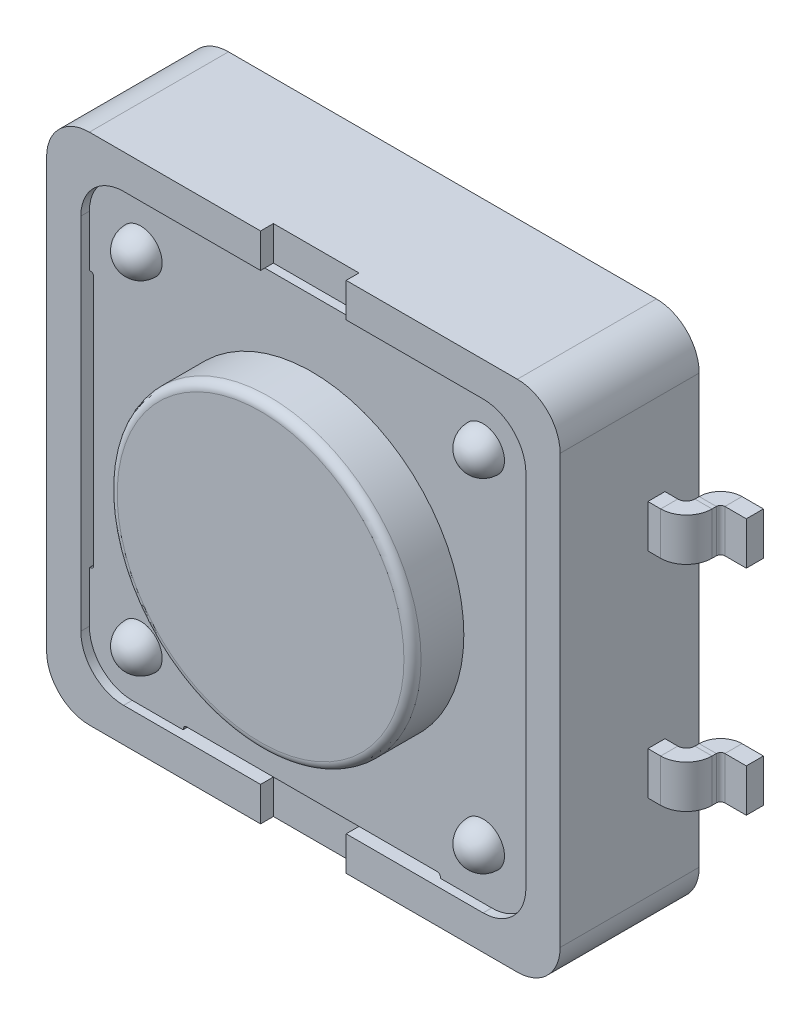
from build123d import *

# Parameters (mm, degrees)
BOSS_EXTRUDE1_DEPTH               = 3.25
BOSS_EXTRUDE3_START               = 0.8
SKETCH2_W                         = 6
SKETCH2_H                         = 1
BOSS_EXTRUDE3_DEPTH               = 0.4
BOSS_EXTRUDE3_2_DEPTH             = 0.4
SM_START                          = 2
SM_EDGE_FLANGE_1_DEPTH            = 1
SM_START_2                        = -3
SM_EDGE_FLANGE_2_DEPTH            = 1
SM_EDGE_FLANGE_3_DEPTH            = 1
SM_EDGE_FLANGE_4_DEPTH            = 1
SM_EDGE_FLANGE_8_STRIP_W          = 1.8
SM_EDGE_FLANGE_8_STRIP_H          = 0.4
SM_EDGE_FLANGE_8_STRIP_CUT_DEPTH  = 1
SM_EDGE_FLANGE_8_DEPTH            = 1
SM_EDGE_FLANGE_9_STRIP_W          = 1.8
SM_EDGE_FLANGE_9_STRIP_H          = 0.4
SM_EDGE_FLANGE_9_STRIP_CUT_DEPTH  = 1
SM_EDGE_FLANGE_9_DEPTH            = 1
SM_EDGE_FLANGE_10_STRIP_W         = 1.8
SM_EDGE_FLANGE_10_STRIP_H         = 0.4
SM_EDGE_FLANGE_10_STRIP_CUT_DEPTH = 1
SM_EDGE_FLANGE_10_DEPTH           = 1
SM_EDGE_FLANGE_11_STRIP_W         = 1.8
SM_EDGE_FLANGE_11_STRIP_H         = 0.4
SM_EDGE_FLANGE_11_STRIP_CUT_DEPTH = 1
SM_EDGE_FLANGE_11_DEPTH           = 1
CUT_EXTRUDE1_DEPTH                = 15.519383596
CUT_EXTRUDE1_DEPTH_BACK           = 15.519383596
SKETCH41_W                        = 2
SKETCH41_H                        = 0.6
BOSS_EXTRUDE4_DEPTH               = 0.1
BOSS_EXTRUDE4_DEPTH_BACK          = 0.4
SKETCH42_R                        = 3.55
SKETCH42_R_2                      = 0.5
SKETCH43_W                        = 10.885963184
SKETCH43_H                        = 10.885963184
BOSS_EXTRUDE5_DEPTH               = 2.55
BOSS_EXTRUDE6_START               = 0.5
SKETCH46_R                        = 0.5
BOSS_EXTRUDE6_DEPTH               = 0.5
BOSS_EXTRUDE6_2_DEPTH             = 0.5
BOSS_EXTRUDE6_3_DEPTH             = 0.5
BOSS_EXTRUDE6_4_DEPTH             = 0.5
FILLET1_R                         = 0.5
FILLET2_R                         = 0.5
FILLET3_R                         = 0.5
FILLET4_R                         = 0.5
BOSS_EXTRUDE7_START               = 0.5
SKETCH47_R                        = 3.55
BOSS_EXTRUDE7_DEPTH               = 1.2
FILLET5_R                         = 0.2
SKETCH48_W                        = 0.053846154
SKETCH48_H                        = 0.3
CUT_EXTRUDE2_DEPTH                = 0.05


# Read off the part's stored shape, not the designer's step: Ребро-кромка1, Ребро-кромка2, Ребро-кромка3, Ребро-кромка4
# Sheet-metal steps are written as plain solids
with BuildPart() as part:
    # Sketch1 → Boss-Extrude1 (new body)
    with BuildSketch(Plane.XY):
        with BuildLine():
            Line((-5, 6), (5, 6))
            ThreePointArc((5, 6), (5.707106781, 5.707106781), (6, 5))
            Line((6, 5), (6, -5))
            ThreePointArc((6, -5), (5.707106781, -5.707106781), (5, -6))
            Line((5, -6), (-5, -6))
            ThreePointArc((-5, -6), (-5.707106781, -5.707106781), (-6, -5))
            Line((-6, -5), (-6, 5))
            ThreePointArc((-6, 5), (-5.707106781, 5.707106781), (-5, 6))
        make_face()
        with BuildLine():
            Line((-4.2, 5.2), (4.2, 5.2))
            ThreePointArc((4.2, 5.2), (4.907106781, 4.907106781), (5.2, 4.2))
            Line((5.2, 4.2), (5.2, -4.2))
            ThreePointArc((5.2, -4.2), (4.907106781, -4.907106781), (4.2, -5.2))
            Line((4.2, -5.2), (-4.2, -5.2))
            ThreePointArc((-4.2, -5.2), (-4.907106781, -4.907106781), (-5.2, -4.2))
            Line((-5.2, -4.2), (-5.2, 4.2))
            ThreePointArc((-5.2, 4.2), (-4.907106781, 4.907106781), (-4.2, 5.2))
        make_face(mode=Mode.SUBTRACT)
    extrude(amount=BOSS_EXTRUDE1_DEPTH)

    # Sketch41 → Cut-Extrude1 (cut, two sides: drawn at the far end of the back side and taken through both)
    with BuildSketch(Plane(origin=(0, -6, 0), x_dir=(-1, 0, 0), z_dir=(0, -1, 0)).offset(-CUT_EXTRUDE1_DEPTH_BACK)):
        with Locations((0, -3.25)):
            Rectangle(SKETCH41_W, SKETCH41_H)
    extrude(amount=CUT_EXTRUDE1_DEPTH + CUT_EXTRUDE1_DEPTH_BACK, mode=Mode.SUBTRACT)

    # Sketch42 → Boss-Extrude4 (add, two sides: drawn at the far end of the back side and taken through both)
    with BuildSketch(Plane.XY.offset(2.95).offset(-BOSS_EXTRUDE4_DEPTH_BACK)):
        with BuildLine():
            Line((-5.2, 3.02), (-5.2, 4.2))
            ThreePointArc((-5.2, 4.2), (-4.907106781, 4.907106781), (-4.2, 5.2))
            Line((-4.2, 5.2), (-3.02, 5.2))
            ThreePointArc((-3.02, 5.2), (-3.005857864, 5.194142136), (-3, 5.18))
            Line((-3, 5.18), (-3, 5.17))
            ThreePointArc((-3, 5.17), (-2.979497475, 5.120502525), (-2.93, 5.1))
            Line((-2.93, 5.1), (2.93, 5.1))
            ThreePointArc((2.93, 5.1), (2.979497475, 5.120502525), (3, 5.17))
            Line((3, 5.17), (3, 5.18))
            ThreePointArc((3, 5.18), (3.005857864, 5.194142136), (3.02, 5.2))
            Line((3.02, 5.2), (4.2, 5.2))
            ThreePointArc((4.2, 5.2), (4.907106781, 4.907106781), (5.2, 4.2))
            Line((5.2, 4.2), (5.2, 3.02))
            ThreePointArc((5.2, 3.02), (5.194142136, 3.005857864), (5.18, 3))
            Line((5.18, 3), (5.17, 3))
            ThreePointArc((5.17, 3), (5.120502525, 2.979497475), (5.1, 2.93))
            Line((5.1, 2.93), (5.1, -2.93))
            ThreePointArc((5.1, -2.93), (5.120502525, -2.979497475), (5.17, -3))
            Line((5.17, -3), (5.18, -3))
            ThreePointArc((5.18, -3), (5.194142136, -3.005857864), (5.2, -3.02))
            Line((5.2, -3.02), (5.2, -4.2))
            ThreePointArc((5.2, -4.2), (4.907106781, -4.907106781), (4.2, -5.2))
            Line((4.2, -5.2), (3.02, -5.2))
            ThreePointArc((3.02, -5.2), (3.005857864, -5.194142136), (3, -5.18))
            Line((3, -5.18), (3, -5.17))
            ThreePointArc((3, -5.17), (2.979497475, -5.120502525), (2.93, -5.1))
            Line((2.93, -5.1), (-2.93, -5.1))
            ThreePointArc((-2.93, -5.1), (-2.979497475, -5.120502525), (-3, -5.17))
            Line((-3, -5.17), (-3, -5.18))
            ThreePointArc((-3, -5.18), (-3.005857864, -5.194142136), (-3.02, -5.2))
            Line((-3.02, -5.2), (-4.2, -5.2))
            ThreePointArc((-4.2, -5.2), (-4.907106781, -4.907106781), (-5.2, -4.2))
            Line((-5.2, -4.2), (-5.2, -3.02))
            ThreePointArc((-5.2, -3.02), (-5.194142136, -3.005857864), (-5.18, -3))
            Line((-5.18, -3), (-5.17, -3))
            ThreePointArc((-5.17, -3), (-5.120502525, -2.979497475), (-5.1, -2.93))
            Line((-5.1, -2.93), (-5.1, 2.93))
            ThreePointArc((-5.1, 2.93), (-5.120502525, 2.979497475), (-5.17, 3))
            Line((-5.17, 3), (-5.18, 3))
            ThreePointArc((-5.18, 3), (-5.194142136, 3.005857864), (-5.2, 3.02))
        make_face()
        Circle(SKETCH42_R, mode=Mode.SUBTRACT)
        with Locations((4, 4)):
            Circle(SKETCH42_R_2, mode=Mode.SUBTRACT)
        with Locations((-4, 4)):
            Circle(SKETCH42_R_2, mode=Mode.SUBTRACT)
        with Locations((-4, -4)):
            Circle(SKETCH42_R_2, mode=Mode.SUBTRACT)
        with Locations((4, -4)):
            Circle(SKETCH42_R_2, mode=Mode.SUBTRACT)
    extrude(amount=BOSS_EXTRUDE4_DEPTH + BOSS_EXTRUDE4_DEPTH_BACK)



with BuildPart() as body_2:
    # Sketch2 → Boss-Extrude3 (new body)
    with BuildSketch(Plane.XY.offset(BOSS_EXTRUDE3_START)):
        with Locations((0, 2.5)):
            Rectangle(SKETCH2_W, SKETCH2_H)
    extrude(amount=BOSS_EXTRUDE3_DEPTH)

    # Ребро-кромка1 outline → Ребро-кромка1 (add)
    with BuildSketch(Plane(origin=(0, 0, 0), x_dir=(1, 0, 0), z_dir=(0, 1, 0)).offset(SM_START)):
        with BuildLine():
            ThreePointArc((-6.9, -0.6), (-6.724264069, -1.024264069), (-6.3, -1.2))
            Line((-6.3, -1.2), (-3, -1.2))
            Line((-3, -1.2), (-3, -0.8))
            Line((-3, -0.8), (-6.3, -0.8))
            ThreePointArc((-6.3, -0.8), (-6.441421356, -0.741421356), (-6.5, -0.6))
            Line((-6.5, -0.6), (-6.5, -0.4))
            Line((-6.5, -0.4), (-6.9, -0.4))
            Line((-6.9, -0.4), (-6.9, -0.6))
        make_face()
    extrude(amount=SM_EDGE_FLANGE_1_DEPTH)

    # Ребро-кромка4 outline → Ребро-кромка4 (add)
    with BuildSketch(Plane(origin=(0, 0, 0), x_dir=(1, 0, 0), z_dir=(0, 1, 0)).offset(SM_START)):
        with BuildLine():
            Line((3, -0.8), (3, -1.2))
            Line((3, -1.2), (6.3, -1.2))
            ThreePointArc((6.3, -1.2), (6.724264069, -1.024264069), (6.9, -0.6))
            Line((6.9, -0.6), (6.9, -0.4))
            Line((6.9, -0.4), (6.5, -0.4))
            Line((6.5, -0.4), (6.5, -0.6))
            ThreePointArc((6.5, -0.6), (6.441421356, -0.741421356), (6.3, -0.8))
            Line((6.3, -0.8), (3, -0.8))
        make_face()
    extrude(amount=SM_EDGE_FLANGE_4_DEPTH)

    # Ребро-кромка8 strip (across the edge) → Ребро-кромка8 strip cut (cut)
    with BuildSketch(Plane(origin=(6.9, 2, 0.4), x_dir=(0, 0, 1), z_dir=(0, 1, 0))):
        with Locations((-0.8, -0.2)):
            Rectangle(SM_EDGE_FLANGE_8_STRIP_W, SM_EDGE_FLANGE_8_STRIP_H)
    extrude(amount=SM_EDGE_FLANGE_8_STRIP_CUT_DEPTH, mode=Mode.SUBTRACT)

    # Ребро-кромка8 section (across the edge) → Ребро-кромка8 (add)
    with BuildSketch(Plane(origin=(6.9, 2, 0.4), x_dir=(0, 0, 1), z_dir=(0, 1, 0))):
        with BuildLine():
            Line((-0.4, 0.1), (-0.4, 0.6))
            Line((-0.4, 0.6), (0, 0.6))
            Line((0, 0.6), (0, 0.1))
            ThreePointArc((0, 0.1), (0.029289322, 0.029289322), (0.1, 0))
            Line((0.1, 0), (0.1, -0.4))
            ThreePointArc((0.1, -0.4), (-0.253553391, -0.253553391), (-0.4, 0.1))
        make_face()
    extrude(amount=SM_EDGE_FLANGE_8_DEPTH)

    # Ребро-кромка11 strip (across the edge) → Ребро-кромка11 strip cut (cut)
    with BuildSketch(Plane(origin=(-6.9, 3, 0.4), x_dir=(0, 0, 1), z_dir=(0, -1, 0))):
        with Locations((-0.8, -0.2)):
            Rectangle(SM_EDGE_FLANGE_11_STRIP_W, SM_EDGE_FLANGE_11_STRIP_H)
    extrude(amount=SM_EDGE_FLANGE_11_STRIP_CUT_DEPTH, mode=Mode.SUBTRACT)

    # Ребро-кромка11 section (across the edge) → Ребро-кромка11 (add)
    with BuildSketch(Plane(origin=(-6.9, 3, 0.4), x_dir=(0, 0, 1), z_dir=(0, -1, 0))):
        with BuildLine():
            Line((-0.4, 0.1), (-0.4, 0.6))
            Line((-0.4, 0.6), (0, 0.6))
            Line((0, 0.6), (0, 0.1))
            ThreePointArc((0, 0.1), (0.029289322, 0.029289322), (0.1, 0))
            Line((0.1, 0), (0.1, -0.4))
            ThreePointArc((0.1, -0.4), (-0.253553391, -0.253553391), (-0.4, 0.1))
        make_face()
    extrude(amount=SM_EDGE_FLANGE_11_DEPTH)


with BuildPart() as body_3:
    # Sketch2 → Boss-Extrude3 2 (new body)
    with BuildSketch(Plane.XY.offset(BOSS_EXTRUDE3_START)):
        with Locations((0, -2.5)):
            Rectangle(SKETCH2_W, SKETCH2_H)
    extrude(amount=BOSS_EXTRUDE3_2_DEPTH)

    # Ребро-кромка2 outline → Ребро-кромка2 (add)
    with BuildSketch(Plane(origin=(0, 0, 0), x_dir=(1, 0, 0), z_dir=(0, 1, 0)).offset(SM_START_2)):
        with BuildLine():
            ThreePointArc((-6.9, -0.6), (-6.724264069, -1.024264069), (-6.3, -1.2))
            Line((-6.3, -1.2), (-3, -1.2))
            Line((-3, -1.2), (-3, -0.8))
            Line((-3, -0.8), (-6.3, -0.8))
            ThreePointArc((-6.3, -0.8), (-6.441421356, -0.741421356), (-6.5, -0.6))
            Line((-6.5, -0.6), (-6.5, -0.4))
            Line((-6.5, -0.4), (-6.9, -0.4))
            Line((-6.9, -0.4), (-6.9, -0.6))
        make_face()
    extrude(amount=SM_EDGE_FLANGE_2_DEPTH)

    # Ребро-кромка3 outline → Ребро-кромка3 (add)
    with BuildSketch(Plane(origin=(0, 0, 0), x_dir=(1, 0, 0), z_dir=(0, 1, 0)).offset(SM_START_2)):
        with BuildLine():
            Line((3, -0.8), (3, -1.2))
            Line((3, -1.2), (6.3, -1.2))
            ThreePointArc((6.3, -1.2), (6.724264069, -1.024264069), (6.9, -0.6))
            Line((6.9, -0.6), (6.9, -0.4))
            Line((6.9, -0.4), (6.5, -0.4))
            Line((6.5, -0.4), (6.5, -0.6))
            ThreePointArc((6.5, -0.6), (6.441421356, -0.741421356), (6.3, -0.8))
            Line((6.3, -0.8), (3, -0.8))
        make_face()
    extrude(amount=SM_EDGE_FLANGE_3_DEPTH)

    # Ребро-кромка9 strip (across the edge) → Ребро-кромка9 strip cut (cut)
    with BuildSketch(Plane(origin=(6.9, -3, 0.4), x_dir=(0, 0, 1), z_dir=(0, 1, 0))):
        with Locations((-0.8, -0.2)):
            Rectangle(SM_EDGE_FLANGE_9_STRIP_W, SM_EDGE_FLANGE_9_STRIP_H)
    extrude(amount=SM_EDGE_FLANGE_9_STRIP_CUT_DEPTH, mode=Mode.SUBTRACT)

    # Ребро-кромка9 section (across the edge) → Ребро-кромка9 (add)
    with BuildSketch(Plane(origin=(6.9, -3, 0.4), x_dir=(0, 0, 1), z_dir=(0, 1, 0))):
        with BuildLine():
            Line((-0.4, 0.1), (-0.4, 0.6))
            Line((-0.4, 0.6), (0, 0.6))
            Line((0, 0.6), (0, 0.1))
            ThreePointArc((0, 0.1), (0.029289322, 0.029289322), (0.1, 0))
            Line((0.1, 0), (0.1, -0.4))
            ThreePointArc((0.1, -0.4), (-0.253553391, -0.253553391), (-0.4, 0.1))
        make_face()
    extrude(amount=SM_EDGE_FLANGE_9_DEPTH)

    # Ребро-кромка10 strip (across the edge) → Ребро-кромка10 strip cut (cut)
    with BuildSketch(Plane(origin=(-6.9, -2, 0.4), x_dir=(0, 0, 1), z_dir=(0, -1, 0))):
        with Locations((-0.8, -0.2)):
            Rectangle(SM_EDGE_FLANGE_10_STRIP_W, SM_EDGE_FLANGE_10_STRIP_H)
    extrude(amount=SM_EDGE_FLANGE_10_STRIP_CUT_DEPTH, mode=Mode.SUBTRACT)

    # Ребро-кромка10 section (across the edge) → Ребро-кромка10 (add)
    with BuildSketch(Plane(origin=(-6.9, -2, 0.4), x_dir=(0, 0, 1), z_dir=(0, -1, 0))):
        with BuildLine():
            Line((-0.4, 0.1), (-0.4, 0.6))
            Line((-0.4, 0.6), (0, 0.6))
            Line((0, 0.6), (0, 0.1))
            ThreePointArc((0, 0.1), (0.029289322, 0.029289322), (0.1, 0))
            Line((0.1, 0), (0.1, -0.4))
            ThreePointArc((0.1, -0.4), (-0.253553391, -0.253553391), (-0.4, 0.1))
        make_face()
    extrude(amount=SM_EDGE_FLANGE_10_DEPTH)


with BuildPart() as part_1:
    add(part.part)

    add(body_2.part)  # Boss-Extrude5 merges body 2

    add(body_3.part)  # Boss-Extrude5 merges body 3
    # Sketch43 → Boss-Extrude5 (add)
    with BuildSketch(Plane(origin=(0, 0, 0), x_dir=(-1, 0, 0), z_dir=(0, 0, -1))):
        Rectangle(SKETCH43_W, SKETCH43_H)
    extrude(amount=-BOSS_EXTRUDE5_DEPTH)

    # Sketch48 → Cut-Extrude2 (cut)
    # profile 1 of 6: a face of its own
    with BuildSketch(Plane(origin=(0, 0, 0), x_dir=(-1, 0, 0), z_dir=(0, 0, -1))):
        with BuildLine():
            Line((-0.514101649, 0.13115306), (-0.554366072, 0.094314118))
            add(Edge.make_bspline(
                [(-0.554366072, 0.094314118), (-0.556090827, 0.096747064), (-0.559402116, 0.101417982), (-0.564769371, 0.107672452), (-0.57011239, 0.11300798), (-0.575480673, 0.117402277), (-0.580921803, 0.120828644), (-0.586426333, 0.12325455), (-0.591963059, 0.124796721), (-0.595682883, 0.124988759), (-0.59751511, 0.125083348)],
                knots=[0, 0, 0, 0, 1.299362458, 2.494594718, 3.587462134, 4.587049575, 5.512617175, 6.380583204, 7.202344345, 8, 8, 8, 8], degree=3))
            add(Edge.make_bspline(
                [(-0.59751511, 0.125083348), (-0.599224159, 0.125023412), (-0.602523883, 0.124907691), (-0.607227885, 0.123757432), (-0.611404164, 0.121772254), (-0.615048646, 0.119176466), (-0.617935614, 0.116049144), (-0.620240633, 0.112769387), (-0.621538553, 0.109149278), (-0.621709384, 0.10666284), (-0.621793956, 0.105431906)],
                knots=[0, 0, 0, 0, 1.185010067, 2.2879431, 3.333075148, 4.379039566, 5.372662701, 6.27520591, 7.14612461, 8, 8, 8, 8], degree=3))
            add(Edge.make_bspline(
                [(-0.621793956, 0.105431906), (-0.621740959, 0.104183221), (-0.621634231, 0.101668544), (-0.62060338, 0.097982971), (-0.619049593, 0.094381738), (-0.617564887, 0.092189495), (-0.616805976, 0.091068925)],
                knots=[0, 0, 0, 0, 0.967525499, 1.948461899, 2.951351359, 4, 4, 4, 4], degree=3))
            add(Edge.make_bspline(
                [(-0.616805976, 0.091068925), (-0.616116043, 0.090197918), (-0.61452791, 0.088192974), (-0.611499664, 0.085017456), (-0.607696824, 0.081127168), (-0.602973048, 0.076655886), (-0.597524432, 0.071442805), (-0.591098427, 0.065692854), (-0.583880001, 0.059227963), (-0.578749311, 0.054726047), (-0.576060783, 0.052367002)],
                knots=[0, 0, 0, 0, 0.473873513, 1.090794244, 1.870441696, 2.795289791, 3.865433203, 5.087734844, 6.473946851, 8, 8, 8, 8], degree=3))
            add(Edge.make_bspline(
                [(-0.576060783, 0.052367002), (-0.573537213, 0.05018298), (-0.568748002, 0.046038158), (-0.561933904, 0.04015525), (-0.555945448, 0.034862541), (-0.550695394, 0.030239464), (-0.546263328, 0.026237511), (-0.542630618, 0.022837553), (-0.539752896, 0.020105782), (-0.53811708, 0.018455791), (-0.537418956, 0.017751618)],
                knots=[0, 0, 0, 0, 1.543621617, 2.929473131, 4.163658386, 5.240097082, 6.164993805, 6.925417477, 7.541396219, 8, 8, 8, 8], degree=3))
            add(Edge.make_bspline(
                [(-0.537418956, 0.017751618), (-0.534770421, 0.014885335), (-0.529679005, 0.009375332), (-0.523061959, 0.000836561), (-0.517615916, -0.00749902), (-0.513402754, -0.01578826), (-0.510220804, -0.024150755), (-0.507977488, -0.032791595), (-0.506633951, -0.041801071), (-0.506484787, -0.047948939), (-0.506409341, -0.051058479)],
                knots=[0, 0, 0, 0, 1.206664779, 2.319633467, 3.337109185, 4.282041471, 5.190008762, 6.099243693, 7.03861361, 8, 8, 8, 8], degree=3))
            add(Edge.make_bspline(
                [(-0.506409341, -0.051058479), (-0.506463041, -0.054088343), (-0.506568404, -0.060033051), (-0.507858889, -0.068732244), (-0.509699046, -0.07705775), (-0.512544252, -0.084918975), (-0.516011972, -0.092444958), (-0.520359259, -0.099518469), (-0.525464552, -0.106211095), (-0.531316002, -0.112403196), (-0.5377884, -0.118022099), (-0.544730662, -0.123024178), (-0.552210673, -0.127154032), (-0.560164525, -0.130554673), (-0.568587961, -0.133173891), (-0.577470944, -0.135109738), (-0.586827064, -0.136271602), (-0.593224913, -0.136393062), (-0.596493476, -0.136455113)],
                knots=[0, 0, 0, 0, 1.043214005, 2.046824704, 3.02475056, 3.976699089, 4.921714032, 5.875962561, 6.831408892, 7.817874052, 8.806269674, 9.781291748, 10.760897367, 11.74438705, 12.757449933, 13.795994037, 14.874007457, 16, 16, 16, 16], degree=3))
            add(Edge.make_bspline(
                [(-0.596493476, -0.136455113), (-0.599059269, -0.136409594), (-0.604141012, -0.136319441), (-0.611630732, -0.135583413), (-0.618862904, -0.134395541), (-0.625829381, -0.132692967), (-0.632561547, -0.130535574), (-0.639059681, -0.127900401), (-0.645278922, -0.124746605), (-0.651266329, -0.121139038), (-0.656992795, -0.116950179), (-0.662530729, -0.112265666), (-0.667825124, -0.10701345), (-0.672901407, -0.101205951), (-0.677727098, -0.094826725), (-0.682460161, -0.087964614), (-0.686890243, -0.080492266), (-0.689626901, -0.075250354), (-0.691024726, -0.072572902)],
                knots=[0, 0, 0, 0, 1.016823716, 2.013894106, 2.979844003, 3.91962641, 4.853723003, 5.779685073, 6.695824784, 7.614987388, 8.547259901, 9.504950863, 10.487499108, 11.500346958, 12.559593716, 13.656357062, 14.802919212, 16, 16, 16, 16], degree=3))
            Line((-0.691024726, -0.072572902), (-0.643668956, -0.044147421))
            add(Edge.make_bspline(
                [(-0.643668956, -0.044147421), (-0.641920487, -0.047186679), (-0.638568521, -0.053013197), (-0.632888303, -0.060841863), (-0.627069208, -0.067545819), (-0.620976707, -0.073006572), (-0.61468488, -0.077297141), (-0.608163337, -0.080363479), (-0.601407496, -0.082261539), (-0.596805724, -0.082493336), (-0.594510302, -0.082608959)],
                knots=[0, 0, 0, 0, 1.283663364, 2.460892379, 3.537111102, 4.529833553, 5.449777664, 6.316464042, 7.160231139, 8, 8, 8, 8], degree=3))
            add(Edge.make_bspline(
                [(-0.594510302, -0.082608959), (-0.59217553, -0.082514535), (-0.587645732, -0.082331338), (-0.581180024, -0.080639206), (-0.575252019, -0.077982434), (-0.570127894, -0.074191586), (-0.565789109, -0.069816371), (-0.562586836, -0.064948745), (-0.560575147, -0.059682091), (-0.560362463, -0.056023527), (-0.560255495, -0.054183479)],
                knots=[0, 0, 0, 0, 1.13588714, 2.203786484, 3.234766741, 4.283437687, 5.291419208, 6.222934724, 7.106237994, 8, 8, 8, 8], degree=3))
            add(Edge.make_bspline(
                [(-0.560255495, -0.054183479), (-0.560354275, -0.052471613), (-0.560554939, -0.048994122), (-0.562032963, -0.043823653), (-0.564343566, -0.038655535), (-0.567077171, -0.034416505), (-0.569858958, -0.030867279), (-0.572518973, -0.027792036), (-0.575758168, -0.024394431), (-0.579568329, -0.02067019), (-0.583899114, -0.016586527), (-0.588754172, -0.012143843), (-0.594189098, -0.007381271), (-0.598030515, -0.004137055), (-0.600039149, -0.00244069)],
                knots=[0, 0, 0, 0, 0.916159276, 1.861089862, 2.860218735, 3.940849679, 4.552606315, 5.27541173, 6.11797699, 7.06649574, 8.129236253, 9.306560635, 10.591630461, 12, 12, 12, 12], degree=3))
            add(Edge.make_bspline(
                [(-0.600039149, -0.00244069), (-0.603857642, 0.000790121), (-0.611186486, 0.006991026), (-0.621543072, 0.016149567), (-0.630875284, 0.024709063), (-0.639102518, 0.032775328), (-0.646329602, 0.040199397), (-0.652507591, 0.04704157), (-0.657568617, 0.053354626), (-0.662894255, 0.060832018), (-0.667954677, 0.069943734), (-0.672328317, 0.080906185), (-0.67516575, 0.091867245), (-0.675483645, 0.099225897), (-0.67564011, 0.102847771)],
                knots=[0, 0, 0, 0, 1.345494975, 2.582412109, 3.71882943, 4.751509156, 5.681369928, 6.505683931, 7.230279997, 7.856715994, 8.973648664, 10.023341002, 11.027102913, 12, 12, 12, 12], degree=3))
            add(Edge.make_bspline(
                [(-0.67564011, 0.102847771), (-0.675575036, 0.10541621), (-0.675446834, 0.110476311), (-0.674303249, 0.117916452), (-0.672594117, 0.125095563), (-0.670111967, 0.131987451), (-0.666890437, 0.138583485), (-0.662978013, 0.144915953), (-0.658313943, 0.150926574), (-0.653057851, 0.156611363), (-0.647266984, 0.161806613), (-0.641078706, 0.166391942), (-0.634528044, 0.170264777), (-0.627655072, 0.173477575), (-0.6204172, 0.175936768), (-0.61286775, 0.177679967), (-0.604995893, 0.178716766), (-0.599641626, 0.178857707), (-0.596914149, 0.178929502)],
                knots=[0, 0, 0, 0, 1.010766082, 1.991317756, 2.957454644, 3.913069143, 4.869106762, 5.843196583, 6.838735724, 7.860187025, 8.887984031, 9.89767229, 10.887916223, 11.879572884, 12.879850636, 13.892031539, 14.926195476, 16, 16, 16, 16], degree=3))
            add(Edge.make_bspline(
                [(-0.596914149, 0.178929502), (-0.593379473, 0.178800196), (-0.586338023, 0.178542605), (-0.575927037, 0.176528326), (-0.56575802, 0.173360659), (-0.557563636, 0.169539218), (-0.551043518, 0.165837387), (-0.546046456, 0.162429206), (-0.540961677, 0.158524953), (-0.535748174, 0.154112322), (-0.530502824, 0.149108175), (-0.525076474, 0.14363164), (-0.519543067, 0.137635385), (-0.51594723, 0.133351688), (-0.514101649, 0.13115306)],
                knots=[0, 0, 0, 0, 1.282922637, 2.555718331, 3.837320111, 5.142675274, 5.830281639, 6.55870424, 7.337177975, 8.157850921, 9.037902056, 9.96903443, 10.957596896, 12, 12, 12, 12], degree=3))
        make_face()
    # profile 2 of 6: a face of its own
    with BuildSketch(Plane(origin=(0, 0, 0), x_dir=(-1, 0, 0), z_dir=(0, 0, -1))):
        Polygon((-0.360195399, 0.171237194), (-0.310255495, 0.171237194), (-0.189101649, -0.128762806), (-0.246613668, -0.128762806), (-0.269930976, -0.067224344), (-0.40064011, -0.067224344), (-0.423957418, -0.128762806), (-0.481409341, -0.128762806), align=None)
        Polygon((-0.335255495, 0.090768444), (-0.380207418, -0.01337819), (-0.290303572, -0.01337819), align=None, mode=Mode.SUBTRACT)
    # profile 3 of 6: a face of its own
    with BuildSketch(Plane(origin=(0, 0, 0), x_dir=(-1, 0, 0), z_dir=(0, 0, -1))):
        with Locations((-0.12564011, 0.021237194)):
            Rectangle(SKETCH48_W, SKETCH48_H)
    # profile 4 of 6: a face of its own
    with BuildSketch(Plane(origin=(0, 0, 0), x_dir=(-1, 0, 0), z_dir=(0, 0, -1))):
        with BuildLine():
            Line((-0.029486264, 0.171237194), (0.033254121, 0.171237194))
            add(Edge.make_bspline(
                [(0.033254121, 0.171237194), (0.037401241, 0.171222475), (0.045377321, 0.171194164), (0.056878394, 0.170747499), (0.067443711, 0.170125928), (0.077088915, 0.169177395), (0.085809879, 0.167919754), (0.093615345, 0.166437204), (0.100505084, 0.16474752), (0.106537202, 0.16264204), (0.11198089, 0.160267091), (0.117055163, 0.157538231), (0.121871969, 0.154485847), (0.126399112, 0.151029622), (0.130675934, 0.147231733), (0.134710503, 0.143088357), (0.138445807, 0.13856436), (0.141858717, 0.133688328), (0.14496931, 0.128558853), (0.147718422, 0.123168894), (0.149954004, 0.117514702), (0.151929381, 0.111677993), (0.15335218, 0.105575328), (0.154341717, 0.09926612), (0.155066217, 0.092728158), (0.155107872, 0.088286557), (0.155129121, 0.086020848)],
                knots=[0, 0, 0, 0, 1.749336639, 3.364467119, 4.854658419, 6.213483162, 7.451590619, 8.570285859, 9.5643256, 10.440900261, 11.26203566, 12.067320669, 12.869050712, 13.665104639, 14.467235401, 15.27997916, 16.102287765, 16.939272006, 17.78853747, 18.631303466, 19.488103222, 20.351255419, 21.228522269, 22.127379805, 23.044756219, 24, 24, 24, 24], degree=3))
            add(Edge.make_bspline(
                [(0.155129121, 0.086020848), (0.155073924, 0.083655969), (0.154965693, 0.079018872), (0.154382703, 0.072207354), (0.153317181, 0.06569057), (0.151703292, 0.059487601), (0.149848337, 0.053521243), (0.147381722, 0.047901579), (0.144597903, 0.042546879), (0.141291644, 0.037532888), (0.137663185, 0.032748235), (0.133443363, 0.028376237), (0.128905559, 0.024181917), (0.123794686, 0.020427992), (0.118336035, 0.016860635), (0.112421149, 0.01362766), (0.106088631, 0.010647797), (0.101636557, 0.00898602), (0.09935989, 0.008136233)],
                knots=[0, 0, 0, 0, 1.099860209, 2.156625411, 3.176576793, 4.16617041, 5.135385252, 6.078461593, 7.016046972, 7.938469504, 8.868247731, 9.803980173, 10.76021508, 11.73834243, 12.748633912, 13.790971185, 14.870363756, 16, 16, 16, 16], degree=3))
            Line((0.09935989, 0.008136233), (0.168590659, -0.128762806))
            Line((0.168590659, -0.128762806), (0.10873489, -0.128762806))
            Line((0.10873489, -0.128762806), (0.042629121, 0.002006425))
            Line((0.042629121, 0.002006425), (0.02435989, 0.002006425))
            Line((0.02435989, 0.002006425), (0.02435989, -0.128762806))
            Line((0.02435989, -0.128762806), (-0.029486264, -0.128762806))
            Line((-0.029486264, -0.128762806), (-0.029486264, 0.171237194))
        make_face()
        with BuildLine():
            Line((0.02435989, 0.055852579), (0.045333448, 0.055852579))
            add(Edge.make_bspline(
                [(0.045333448, 0.055852579), (0.047897639, 0.055881459), (0.052807516, 0.055936757), (0.059868562, 0.056193254), (0.066281677, 0.056811284), (0.072074399, 0.057592141), (0.077275878, 0.058493754), (0.081839717, 0.059785821), (0.085836239, 0.061170302), (0.089218085, 0.062890854), (0.092107456, 0.064847494), (0.094602243, 0.067070286), (0.09666579, 0.069642885), (0.098364194, 0.072495379), (0.099685368, 0.075652996), (0.100649723, 0.079081074), (0.101188656, 0.082818663), (0.101250662, 0.085398109), (0.101282967, 0.086742002)],
                knots=[0, 0, 0, 0, 1.688639943, 3.233382647, 4.650958383, 5.928841754, 7.082724185, 8.122798841, 9.049171256, 9.863274652, 10.613301712, 11.341792392, 12.054588806, 12.776240173, 13.521029143, 14.301969904, 15.115324896, 16, 16, 16, 16], degree=3))
            add(Edge.make_bspline(
                [(0.101282967, 0.086742002), (0.101221891, 0.088331926), (0.101101919, 0.091455037), (0.099911421, 0.095951221), (0.098016406, 0.100112747), (0.09541886, 0.103920812), (0.092147588, 0.107259225), (0.088393545, 0.110202063), (0.084075711, 0.112529039), (0.080077721, 0.114063887), (0.076440484, 0.114982203), (0.073157993, 0.115666523), (0.069356849, 0.116151521), (0.065034182, 0.116665948), (0.06020101, 0.116999527), (0.05483099, 0.117242974), (0.048939545, 0.11734258), (0.044832648, 0.117374422), (0.042689217, 0.117391041)],
                knots=[0, 0, 0, 0, 1.020303359, 2.004196876, 2.966617323, 3.9489082, 4.950758222, 5.960522915, 7.003732012, 8.091992268, 8.70421221, 9.413913587, 10.24622431, 11.166358409, 12.212345909, 13.359657661, 14.621978493, 16, 16, 16, 16], degree=3))
            Line((0.042689217, 0.117391041), (0.02435989, 0.117391041))
            Line((0.02435989, 0.117391041), (0.02435989, 0.055852579))
        make_face(mode=Mode.SUBTRACT)
    # profile 5 of 6: a face of its own
    with BuildSketch(Plane(origin=(0, 0, 0), x_dir=(-1, 0, 0), z_dir=(0, 0, -1))):
        with BuildLine():
            Line((0.212821428, 0.171237194), (0.266667582, 0.171237194))
            Line((0.266667582, 0.171237194), (0.266667582, -0.023955113))
            add(Edge.make_bspline(
                [(0.266667582, -0.023955113), (0.26667051, -0.025978782), (0.266676165, -0.029887479), (0.266959267, -0.035495178), (0.267218324, -0.040649827), (0.267685737, -0.045345784), (0.268376267, -0.049585057), (0.269044925, -0.053394878), (0.269949887, -0.056707036), (0.2713099, -0.060477138), (0.273405235, -0.064713054), (0.276828895, -0.069127823), (0.280779506, -0.073156941), (0.285514541, -0.076510625), (0.290836302, -0.079223454), (0.296715547, -0.08123336), (0.30314399, -0.082350601), (0.307588905, -0.082521168), (0.309876717, -0.082608959)],
                knots=[0, 0, 0, 0, 1.155499968, 2.231836252, 3.205919964, 4.102923608, 4.924856345, 5.658536265, 6.31071849, 6.882491295, 7.94666036, 8.992281882, 10.060072772, 11.158554251, 12.289267114, 13.461410017, 14.693379945, 16, 16, 16, 16], degree=3))
            add(Edge.make_bspline(
                [(0.309876717, -0.082608959), (0.312307234, -0.082538035), (0.317046332, -0.082399745), (0.323862769, -0.081042276), (0.330178237, -0.07888072), (0.335859016, -0.07579563), (0.340899452, -0.072097608), (0.345166075, -0.067880704), (0.348533278, -0.063136508), (0.350727896, -0.058759626), (0.351960066, -0.054731087), (0.352883639, -0.05113174), (0.35356072, -0.046884868), (0.35417499, -0.042056793), (0.354544119, -0.036597506), (0.354944379, -0.030550913), (0.355091078, -0.023875639), (0.355116082, -0.019227521), (0.355129121, -0.016803671)],
                knots=[0, 0, 0, 0, 1.261321664, 2.459363699, 3.594844139, 4.716940403, 5.803436589, 6.833651888, 7.818396249, 8.814403945, 9.360733334, 10.004355033, 10.743453831, 11.592799886, 12.532235708, 13.585170094, 14.740740724, 16, 16, 16, 16], degree=3))
            Line((0.355129121, -0.016803671), (0.355129121, 0.171237194))
            Line((0.355129121, 0.171237194), (0.408975274, 0.171237194))
            Line((0.408975274, 0.171237194), (0.408975274, -0.007729152))
            add(Edge.make_bspline(
                [(0.408975274, -0.007729152), (0.408967797, -0.011355001), (0.408953418, -0.018327156), (0.408732607, -0.028346634), (0.408262541, -0.03749782), (0.407867739, -0.045783387), (0.407103663, -0.053192175), (0.406307674, -0.05975582), (0.405293118, -0.065451062), (0.40378352, -0.071934404), (0.401178401, -0.079399734), (0.396978607, -0.087995738), (0.39164724, -0.096411747), (0.385345831, -0.104555179), (0.378230964, -0.112120164), (0.37046039, -0.118761242), (0.362157565, -0.124378878), (0.353235731, -0.128835714), (0.343702479, -0.13231171), (0.333463487, -0.134647404), (0.322525735, -0.136225428), (0.314970823, -0.136377017), (0.31107864, -0.136455113)],
                knots=[0, 0, 0, 0, 1.170808336, 2.251350247, 3.235597562, 4.129743112, 4.929140599, 5.639994148, 6.264258765, 6.79612947, 7.788252245, 8.809469599, 9.879094798, 10.999557536, 12.129761673, 13.226370002, 14.293821979, 15.358369427, 16.438775801, 17.562147481, 18.744053101, 20, 20, 20, 20], degree=3))
            add(Edge.make_bspline(
                [(0.31107864, -0.136455113), (0.308492596, -0.136411555), (0.303390385, -0.136325615), (0.295886688, -0.135567848), (0.28863289, -0.134451185), (0.281642623, -0.132822089), (0.274891623, -0.130717602), (0.268381685, -0.128127124), (0.262137, -0.125065105), (0.256192514, -0.12155971), (0.250555541, -0.117769228), (0.245403639, -0.113567319), (0.240559518, -0.109264731), (0.236163124, -0.104680392), (0.232181435, -0.099862429), (0.228622651, -0.094799924), (0.225492061, -0.089493326), (0.222710915, -0.083846985), (0.220330525, -0.077573916), (0.218323767, -0.070450985), (0.216570617, -0.062366547), (0.215267778, -0.053302387), (0.214086618, -0.043288381), (0.213339008, -0.03229844), (0.2129479, -0.020332249), (0.212864651, -0.012036336), (0.212821428, -0.007729152)],
                knots=[0, 0, 0, 0, 1.001158378, 1.975264943, 2.917723546, 3.841610987, 4.75185031, 5.653588123, 6.552117133, 7.442167995, 8.324307438, 9.179605724, 10.014504199, 10.831958861, 11.636465792, 12.43274043, 13.225645099, 14.020104002, 14.867201867, 15.819789774, 16.883317127, 18.068162734, 19.364263498, 20.787406516, 22.332041935, 24, 24, 24, 24], degree=3))
            Line((0.212821428, -0.007729152), (0.212821428, 0.171237194))
        make_face()
    # profile 6 of 6: a face of its own
    with BuildSketch(Plane(origin=(0, 0, 0), x_dir=(-1, 0, 0), z_dir=(0, 0, -1))):
        with BuildLine():
            Line((0.632052198, 0.13115306), (0.591787774, 0.094314118))
            add(Edge.make_bspline(
                [(0.591787774, 0.094314118), (0.590063019, 0.096747064), (0.58675173, 0.101417982), (0.581384475, 0.107672452), (0.576041456, 0.11300798), (0.570673173, 0.117402277), (0.565232043, 0.120828644), (0.559727513, 0.12325455), (0.554190788, 0.124796721), (0.550470963, 0.124988759), (0.548638736, 0.125083348)],
                knots=[0, 0, 0, 0, 1.299362458, 2.494594718, 3.587462134, 4.587049575, 5.512617175, 6.380583204, 7.202344345, 8, 8, 8, 8], degree=3))
            add(Edge.make_bspline(
                [(0.548638736, 0.125083348), (0.546929687, 0.125023412), (0.543629963, 0.124907691), (0.538925961, 0.123757432), (0.534749682, 0.121772254), (0.5311052, 0.119176466), (0.528218233, 0.116049144), (0.525913213, 0.112769387), (0.524615293, 0.109149278), (0.524444462, 0.10666284), (0.52435989, 0.105431906)],
                knots=[0, 0, 0, 0, 1.185010067, 2.2879431, 3.333075148, 4.379039566, 5.372662701, 6.27520591, 7.14612461, 8, 8, 8, 8], degree=3))
            add(Edge.make_bspline(
                [(0.52435989, 0.105431906), (0.524412887, 0.104183221), (0.524519615, 0.101668544), (0.525550466, 0.097982971), (0.527104253, 0.094381738), (0.528588959, 0.092189495), (0.529347871, 0.091068925)],
                knots=[0, 0, 0, 0, 0.967525499, 1.948461899, 2.951351359, 4, 4, 4, 4], degree=3))
            add(Edge.make_bspline(
                [(0.529347871, 0.091068925), (0.530037803, 0.090197918), (0.531625937, 0.088192974), (0.534654182, 0.085017456), (0.538457022, 0.081127168), (0.543180798, 0.076655886), (0.548629414, 0.071442805), (0.555055419, 0.065692854), (0.562273845, 0.059227963), (0.567404535, 0.054726047), (0.570093063, 0.052367002)],
                knots=[0, 0, 0, 0, 0.473873513, 1.090794244, 1.870441696, 2.795289791, 3.865433203, 5.087734844, 6.473946851, 8, 8, 8, 8], degree=3))
            add(Edge.make_bspline(
                [(0.570093063, 0.052367002), (0.572616633, 0.05018298), (0.577405845, 0.046038158), (0.584219942, 0.04015525), (0.590208398, 0.034862541), (0.595458452, 0.030239464), (0.599890518, 0.026237511), (0.603523228, 0.022837553), (0.60640095, 0.020105782), (0.608036766, 0.018455791), (0.60873489, 0.017751618)],
                knots=[0, 0, 0, 0, 1.543621617, 2.929473131, 4.163658386, 5.240097082, 6.164993805, 6.925417477, 7.541396219, 8, 8, 8, 8], degree=3))
            add(Edge.make_bspline(
                [(0.60873489, 0.017751618), (0.611383426, 0.014885335), (0.616474842, 0.009375332), (0.623091887, 0.000836561), (0.62853793, -0.00749902), (0.632751092, -0.01578826), (0.635933042, -0.024150755), (0.638176358, -0.032791595), (0.639519895, -0.041801071), (0.639669059, -0.047948939), (0.639744505, -0.051058479)],
                knots=[0, 0, 0, 0, 1.206664779, 2.319633467, 3.337109185, 4.282041471, 5.190008762, 6.099243693, 7.03861361, 8, 8, 8, 8], degree=3))
            add(Edge.make_bspline(
                [(0.639744505, -0.051058479), (0.639690805, -0.054088343), (0.639585442, -0.060033051), (0.638294957, -0.068732244), (0.6364548, -0.07705775), (0.633609594, -0.084918975), (0.630141874, -0.092444958), (0.625794587, -0.099518469), (0.620689294, -0.106211095), (0.614837844, -0.112403196), (0.608365446, -0.118022099), (0.601423184, -0.123024178), (0.593943173, -0.127154032), (0.585989321, -0.130554673), (0.577565886, -0.133173891), (0.568682902, -0.135109738), (0.559326782, -0.136271602), (0.552928933, -0.136393062), (0.549660371, -0.136455113)],
                knots=[0, 0, 0, 0, 1.043214005, 2.046824704, 3.02475056, 3.976699089, 4.921714032, 5.875962561, 6.831408892, 7.817874052, 8.806269674, 9.781291748, 10.760897367, 11.74438705, 12.757449933, 13.795994037, 14.874007457, 16, 16, 16, 16], degree=3))
            add(Edge.make_bspline(
                [(0.549660371, -0.136455113), (0.547094577, -0.136409594), (0.542012834, -0.136319441), (0.534523114, -0.135583413), (0.527290942, -0.134395541), (0.520324466, -0.132692967), (0.513592299, -0.130535574), (0.507094165, -0.127900401), (0.500874924, -0.124746605), (0.494887518, -0.121139038), (0.489161051, -0.116950179), (0.483623117, -0.112265666), (0.478328722, -0.10701345), (0.473252439, -0.101205951), (0.468426748, -0.094826725), (0.463693685, -0.087964614), (0.459263604, -0.080492266), (0.456526945, -0.075250354), (0.455129121, -0.072572902)],
                knots=[0, 0, 0, 0, 1.016823716, 2.013894106, 2.979844003, 3.91962641, 4.853723003, 5.779685073, 6.695824784, 7.614987388, 8.547259901, 9.504950863, 10.487499108, 11.500346958, 12.559593716, 13.656357062, 14.802919212, 16, 16, 16, 16], degree=3))
            Line((0.455129121, -0.072572902), (0.50248489, -0.044147421))
            add(Edge.make_bspline(
                [(0.50248489, -0.044147421), (0.504233359, -0.047186679), (0.507585325, -0.053013197), (0.513265544, -0.060841863), (0.519084638, -0.067545819), (0.525177139, -0.073006572), (0.531468966, -0.077297141), (0.537990509, -0.080363479), (0.54474635, -0.082261539), (0.549348122, -0.082493336), (0.551643544, -0.082608959)],
                knots=[0, 0, 0, 0, 1.283663364, 2.460892379, 3.537111102, 4.529833553, 5.449777664, 6.316464042, 7.160231139, 8, 8, 8, 8], degree=3))
            add(Edge.make_bspline(
                [(0.551643544, -0.082608959), (0.553978316, -0.082514535), (0.558508114, -0.082331338), (0.564973822, -0.080639206), (0.570901828, -0.077982434), (0.576025952, -0.074191586), (0.580364737, -0.069816371), (0.58356701, -0.064948745), (0.585578699, -0.059682091), (0.585791383, -0.056023527), (0.585898351, -0.054183479)],
                knots=[0, 0, 0, 0, 1.13588714, 2.203786484, 3.234766741, 4.283437687, 5.291419208, 6.222934724, 7.106237994, 8, 8, 8, 8], degree=3))
            add(Edge.make_bspline(
                [(0.585898351, -0.054183479), (0.585799571, -0.052471613), (0.585598907, -0.048994122), (0.584120883, -0.043823653), (0.581810281, -0.038655535), (0.579076675, -0.034416505), (0.576294888, -0.030867279), (0.573634873, -0.027792036), (0.570395678, -0.024394431), (0.566585517, -0.02067019), (0.562254732, -0.016586527), (0.557399674, -0.012143843), (0.551964748, -0.007381271), (0.548123331, -0.004137055), (0.546114698, -0.00244069)],
                knots=[0, 0, 0, 0, 0.916159276, 1.861089862, 2.860218735, 3.940849679, 4.552606315, 5.27541173, 6.11797699, 7.06649574, 8.129236253, 9.306560635, 10.591630461, 12, 12, 12, 12], degree=3))
            add(Edge.make_bspline(
                [(0.546114698, -0.00244069), (0.542296204, 0.000790121), (0.53496736, 0.006991026), (0.524610774, 0.016149567), (0.515278562, 0.024709063), (0.507051328, 0.032775328), (0.499824244, 0.040199397), (0.493646255, 0.04704157), (0.488585229, 0.053354626), (0.483259591, 0.060832018), (0.47819917, 0.069943734), (0.473825529, 0.080906185), (0.470988096, 0.091867245), (0.470670202, 0.099225897), (0.470513736, 0.102847771)],
                knots=[0, 0, 0, 0, 1.345494975, 2.582412109, 3.71882943, 4.751509156, 5.681369928, 6.505683931, 7.230279997, 7.856715994, 8.973648664, 10.023341002, 11.027102913, 12, 12, 12, 12], degree=3))
            add(Edge.make_bspline(
                [(0.470513736, 0.102847771), (0.47057881, 0.10541621), (0.470707012, 0.110476311), (0.471850597, 0.117916452), (0.473559729, 0.125095563), (0.476041879, 0.131987451), (0.47926341, 0.138583485), (0.483175834, 0.144915953), (0.487839903, 0.150926574), (0.493095995, 0.156611363), (0.498886862, 0.161806613), (0.50507514, 0.166391942), (0.511625802, 0.170264777), (0.518498774, 0.173477575), (0.525736646, 0.175936768), (0.533286096, 0.177679967), (0.541157953, 0.178716766), (0.54651222, 0.178857707), (0.549239698, 0.178929502)],
                knots=[0, 0, 0, 0, 1.010766082, 1.991317756, 2.957454644, 3.913069143, 4.869106762, 5.843196583, 6.838735724, 7.860187025, 8.887984031, 9.89767229, 10.887916223, 11.879572884, 12.879850636, 13.892031539, 14.926195476, 16, 16, 16, 16], degree=3))
            add(Edge.make_bspline(
                [(0.549239698, 0.178929502), (0.552774373, 0.178800196), (0.559815823, 0.178542605), (0.57022681, 0.176528326), (0.580395826, 0.173360659), (0.58859021, 0.169539218), (0.595110329, 0.165837387), (0.60010739, 0.162429206), (0.60519217, 0.158524953), (0.610405672, 0.154112322), (0.615651023, 0.149108175), (0.621077372, 0.14363164), (0.626610779, 0.137635385), (0.630206616, 0.133351688), (0.632052198, 0.13115306)],
                knots=[0, 0, 0, 0, 1.282922637, 2.555718331, 3.837320111, 5.142675274, 5.830281639, 6.55870424, 7.337177975, 8.157850921, 9.037902056, 9.96903443, 10.957596896, 12, 12, 12, 12], degree=3))
        make_face()
    extrude(amount=-CUT_EXTRUDE2_DEPTH, mode=Mode.SUBTRACT)


with BuildPart() as body_2_2:
    # Sketch46 → Boss-Extrude6 (new body)
    with BuildSketch(Plane.XY.offset(2.55).offset(BOSS_EXTRUDE6_START)):
        with Locations((-4, 4)):
            Circle(SKETCH46_R)
    extrude(amount=BOSS_EXTRUDE6_DEPTH)

    # Fillet1
    # the kernel refuses this fillet: 0.5 mm, written as the material it takes off along each edge
    with BuildSketch(Plane(origin=(-4, 4, 3.55), x_dir=(1, 0, 0), z_dir=(0, -1, 0))) as fillet1_piece_1:
        with BuildLine():
            CenterArc((0.5 - FILLET1_R, -FILLET1_R), FILLET1_R, 0, 90)
            Line((0.5 - FILLET1_R, 0), (0.5, 0))
            Line((0.5, 0), (0.5, -FILLET1_R))
        make_face()
    revolve(axis=Axis((-4, 4, 3.55), (0, 0, 1)), mode=Mode.SUBTRACT)


with BuildPart() as body_3_2:
    # Sketch46 → Boss-Extrude6 2 (new body)
    with BuildSketch(Plane.XY.offset(2.55).offset(BOSS_EXTRUDE6_START)):
        with Locations((4, 4)):
            Circle(SKETCH46_R)
    extrude(amount=BOSS_EXTRUDE6_2_DEPTH)

    # Fillet2
    # the kernel refuses this fillet: 0.5 mm, written as the material it takes off along each edge
    with BuildSketch(Plane(origin=(4, 4, 3.55), x_dir=(1, 0, 0), z_dir=(0, -1, 0))) as fillet2_piece_1:
        with BuildLine():
            CenterArc((0.5 - FILLET2_R, -FILLET2_R), FILLET2_R, 0, 90)
            Line((0.5 - FILLET2_R, 0), (0.5, 0))
            Line((0.5, 0), (0.5, -FILLET2_R))
        make_face()
    revolve(axis=Axis((4, 4, 3.55), (0, 0, 1)), mode=Mode.SUBTRACT)


with BuildPart() as body_4:
    # Sketch46 → Boss-Extrude6 3 (new body)
    with BuildSketch(Plane.XY.offset(2.55).offset(BOSS_EXTRUDE6_START)):
        with Locations((4, -4)):
            Circle(SKETCH46_R)
    extrude(amount=BOSS_EXTRUDE6_3_DEPTH)

    # Fillet3
    # the kernel refuses this fillet: 0.5 mm, written as the material it takes off along each edge
    with BuildSketch(Plane(origin=(4, -4, 3.55), x_dir=(1, 0, 0), z_dir=(0, -1, 0))) as fillet3_piece_1:
        with BuildLine():
            CenterArc((0.5 - FILLET3_R, -FILLET3_R), FILLET3_R, 0, 90)
            Line((0.5 - FILLET3_R, 0), (0.5, 0))
            Line((0.5, 0), (0.5, -FILLET3_R))
        make_face()
    revolve(axis=Axis((4, -4, 3.55), (0, 0, 1)), mode=Mode.SUBTRACT)


with BuildPart() as body_5:
    # Sketch46 → Boss-Extrude6 4 (new body)
    with BuildSketch(Plane.XY.offset(2.55).offset(BOSS_EXTRUDE6_START)):
        with Locations((-4, -4)):
            Circle(SKETCH46_R)
    extrude(amount=BOSS_EXTRUDE6_4_DEPTH)

    # Fillet4
    # the kernel refuses this fillet: 0.5 mm, written as the material it takes off along each edge
    with BuildSketch(Plane(origin=(-4, -4, 3.55), x_dir=(1, 0, 0), z_dir=(0, -1, 0))) as fillet4_piece_1:
        with BuildLine():
            CenterArc((0.5 - FILLET4_R, -FILLET4_R), FILLET4_R, 0, 90)
            Line((0.5 - FILLET4_R, 0), (0.5, 0))
            Line((0.5, 0), (0.5, -FILLET4_R))
        make_face()
    revolve(axis=Axis((-4, -4, 3.55), (0, 0, 1)), mode=Mode.SUBTRACT)


with BuildPart() as body_6:
    # Sketch47 → Boss-Extrude7 (new body)
    with BuildSketch(Plane.XY.offset(2.55).offset(BOSS_EXTRUDE7_START)):
        Circle(SKETCH47_R)
    extrude(amount=BOSS_EXTRUDE7_DEPTH)

    # Fillet5
    fillet5_edges = [body_6.edges().sort_by_distance(p)[0] for p in [
        (-3.55, 0, 4.25),
    ]]
    fillet(fillet5_edges, radius=FILLET5_R)


solid = Compound([part_1.part, body_2_2.part, body_3_2.part, body_4.part, body_5.part, body_6.part])
